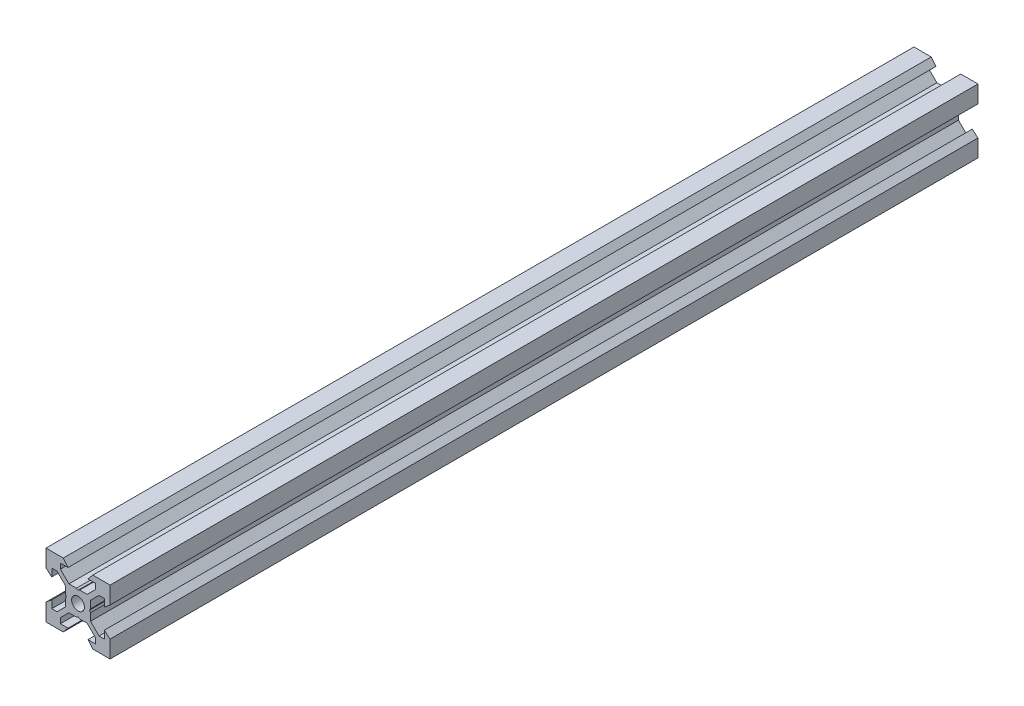
from build123d import *

# Parameters (mm, degrees)
SKETCH1_R           = 2
BOSS_EXTRUDE1_DEPTH = 135.5


with BuildPart() as part:
    # Sketch1 → Boss-Extrude1 (new, symmetric)
    with BuildSketch(Plane.XY):
        Polygon((10, 4.610379336), (10, 10), (4.610379336, 10), (3.1, 8.2), (5.5, 8.2), (5.5, 6.560660172), (2.839339828, 3.9), (0.519615242, 3.9), (0, 3.6), (-0.519615242, 3.9), (-2.839339828, 3.9), (-5.5, 6.560660172), (-5.5, 8.2), (-3.1, 8.2), (-4.610379336, 10), (-10, 10), (-10, 4.610379336), (-8.2, 3.1), (-8.2, 5.5), (-6.560660172, 5.5), (-3.9, 2.839339828), (-3.9, 0.519615242), (-3.6, 0), (-3.9, -0.519615242), (-3.9, -2.839339828), (-6.560660172, -5.5), (-8.2, -5.5), (-8.2, -3.1), (-10, -4.610379336), (-10, -10), (-4.610379336, -10), (-3.1, -8.2), (-5.5, -8.2), (-5.5, -6.560660172), (-2.839339828, -3.9), (-0.519615242, -3.9), (0, -3.6), (0.519615242, -3.9), (2.839339828, -3.9), (5.5, -6.560660172), (5.5, -8.2), (3.1, -8.2), (4.610379336, -10), (10, -10), (10, -4.610379336), (8.2, -3.1), (8.2, -5.5), (6.560660172, -5.5), (3.9, -2.839339828), (3.9, -0.519615242), (3.6, 0), (3.9, 0.519615242), (3.9, 2.839339828), (6.560660172, 5.5), (8.2, 5.5), (8.2, 3.1), align=None)
        Circle(SKETCH1_R, mode=Mode.SUBTRACT)
    extrude(amount=BOSS_EXTRUDE1_DEPTH, both=True)


solid = part.part
